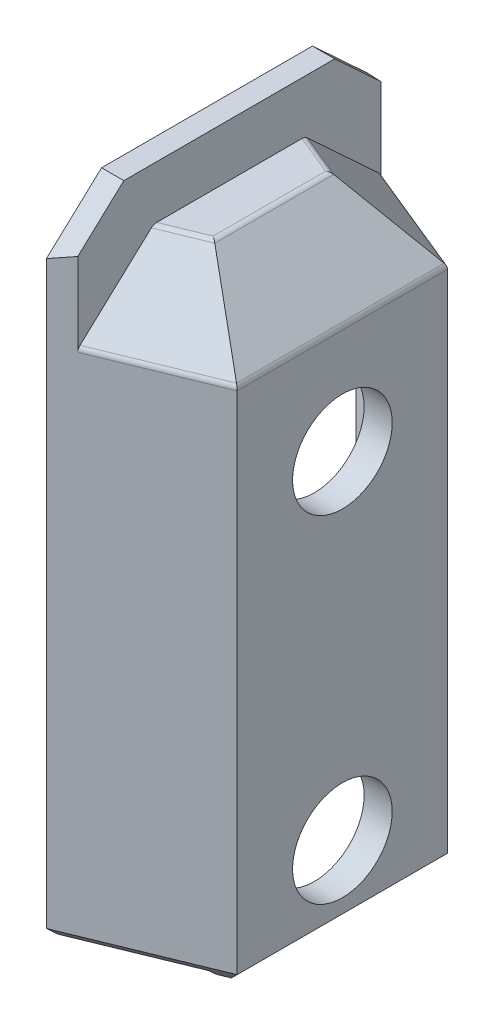
from build123d import *

# Parameters (mm, degrees)
SKETCH1_W            = 30
SKETCH1_H            = 5
BOSS_EXTRUDE1_DEPTH  = 19.3
SKETCH2_W            = 40
SKETCH2_H            = 10
BOSS_EXTRUDE2_DEPTH  = 3.175
SKETCH3_W            = 4
SKETCH3_H            = 30
BOSS_EXTRUDE3_DEPTH  = 75
CUT_EXTRUDE1_REACH   = 84.48
SKETCH4_R            = 7.1
BOSS_EXTRUDE7_DEPTH  = 5
BOSS_EXTRUDE8_DEPTH  = 5
CHAMFER1_SIZE        = 5
BOSS_EXTRUDE9_DEPTH  = 75
BOSS_EXTRUDE10_DEPTH = 5
CHAMFER2_SIZE        = 5
CHAMFER3_SIZE        = 10
BOSS_EXTRUDE15_DEPTH = 3.175
CUT_EXTRUDE2_DEPTH   = 81.759021382
FILLET6_R            = 1
FILLET7_R            = 1
CHAMFER6_SIZE        = 2.5


with BuildPart() as part:
    # Sketch1 → Boss-Extrude1 (new body)
    with BuildSketch(Plane(origin=(0, 0, 0), x_dir=(0, 0, -1), z_dir=(1, 0, 0))):
        Rectangle(SKETCH1_W, SKETCH1_H)
    extrude(amount=BOSS_EXTRUDE1_DEPTH)

    # Sketch2 → Boss-Extrude2 (add)
    with BuildSketch(Plane.ZY):
        with Locations((0.597390222, 2.5)):
            Rectangle(SKETCH2_W, SKETCH2_H)
    extrude(amount=-BOSS_EXTRUDE2_DEPTH)

    # Sketch3 → Boss-Extrude3 (add)
    with BuildSketch(Plane.XZ.offset(2.5)):
        with Locations((17.3, 0)):
            Rectangle(SKETCH3_W, SKETCH3_H)
    extrude(amount=BOSS_EXTRUDE3_DEPTH)

    # Sketch4 → Cut-Extrude1 (cut, up to next)
    with BuildSketch(Plane(origin=(19.3, 0, 0), x_dir=(0, 0, -1), z_dir=(1, 0, 0)), mode=Mode.PRIVATE) as cut_extrude1_sk1:
        with Locations((2.035e-06, -17.9)):
            Circle(SKETCH4_R)
    cut_extrude1_tool1 = extrude(cut_extrude1_sk1.sketch, amount=-CUT_EXTRUDE1_REACH, mode=Mode.PRIVATE) & part.part
    # Sketch4 → Cut-Extrude1 (cut, up to next)
    with BuildSketch(Plane(origin=(19.3, 0, 0), x_dir=(0, 0, -1), z_dir=(1, 0, 0)), mode=Mode.PRIVATE) as cut_extrude1_sk2:
        with Locations((-1.3e-07, -65.9)):
            Circle(SKETCH4_R)
    cut_extrude1_tool2 = extrude(cut_extrude1_sk2.sketch, amount=-CUT_EXTRUDE1_REACH, mode=Mode.PRIVATE) & part.part
    add(cut_extrude1_tool1.solids().sort_by_distance((19.3, -17.9, -2e-06))[0], mode=Mode.SUBTRACT)
    add(cut_extrude1_tool2.solids().sort_by_distance((19.3, -65.9, 0))[0], mode=Mode.SUBTRACT)

    # Sketch10 → Boss-Extrude7 (add)
    with BuildSketch(Plane(origin=(0, 2.5, 0), x_dir=(1, 0, 0), z_dir=(0, 1, 0))):
        Polygon((3.175, 19.402609778), (0, 19.402609778), (0, 22.902609778), (19.3, 15), (3.175, 15), align=None)
    boss_extrude7 = extrude(amount=-BOSS_EXTRUDE7_DEPTH)

    # Sketch11 → Boss-Extrude8 (add)
    with BuildSketch(Plane(origin=(0, 2.5, 0), x_dir=(1, 0, 0), z_dir=(0, 1, 0))):
        Polygon((0, 19.402609778), (0, 22.902609778), (3.175, 21.60256905), (3.175, 19.402609778), align=None)
    boss_extrude8 = extrude(amount=BOSS_EXTRUDE8_DEPTH)

    # Mirror2: Boss-Extrude7, Boss-Extrude8 across plane
    add(boss_extrude7.mirror(Plane(origin=(0, 0, 0), x_dir=(1, 0, 0), z_dir=(0, 0, -1))))
    add(boss_extrude8.mirror(Plane(origin=(0, 0, 0), x_dir=(1, 0, 0), z_dir=(0, 0, -1))))

    # Chamfer1
    chamfer1_edges = [part.edges().sort_by_distance(p)[0] for p in [
        (3.175, 2.5, 0),
    ]]
    chamfer(chamfer1_edges, length=CHAMFER1_SIZE - 0.0001)  # a hair under: the kernel refuses the full size

    # Sketch12 → Boss-Extrude9 (add)
    with BuildSketch(Plane.XZ.offset(2.5)):
        Polygon((0, -22.902609778), (19.3, -15), (15.3, -15), (0, -21.264763192), align=None)
        Polygon((0, 22.902609778), (19.3, 15), (15.3, 15), (0, 21.264763192), align=None)
    extrude(amount=BOSS_EXTRUDE9_DEPTH)

    # Sketch13 → Boss-Extrude10 (add)
    with BuildSketch(Plane(origin=(0, 2.5, 0), x_dir=(1, 0, 0), z_dir=(0, 1, 0))):
        Polygon((3.175, 21.60256905), (3.175, -21.60256905), (19.3, -15), (19.3, 15), align=None)
    extrude(amount=BOSS_EXTRUDE10_DEPTH)

    # Chamfer2
    chamfer2_edges = [part.edges().sort_by_distance(p)[0] for p in [
        (7.65, -2.5, -18.132381596),
        (7.65, -2.5, 18.132381596),
        (15.3, -2.5, 0),
    ]]
    chamfer(chamfer2_edges, length=CHAMFER2_SIZE)

    # Chamfer3
    chamfer3_edges = [part.edges().sort_by_distance(p)[0] for p in [
        (9.65, 7.5, 18.951304889),
        (19.3, 7.5, 0),
        (9.65, 7.5, -18.951304889),
    ]]
    chamfer(chamfer3_edges, length=CHAMFER3_SIZE)

    # Sketch14 → Boss-Extrude15 (add)
    with BuildSketch(Plane.ZY):
        Polygon((-22.902609778, -2.5), (-22.902609778, 7.718772797), (-15.034642071, 15), (15.034642071, 15), (22.902609778, 7.718772797), (22.902609778, -2.5), align=None)
    extrude(amount=-BOSS_EXTRUDE15_DEPTH)

    # Sketch15 → Cut-Extrude2 (cut, through all)
    with BuildSketch(Plane.XZ.offset(2.5)):
        Polygon((3.175, 22.902609778), (0, 22.902609778), (3.175, 21.60256905), align=None)
        Polygon((3.175, -22.902609778), (3.175, -21.60256905), (0, -22.902609778), align=None)
    extrude(amount=-CUT_EXTRUDE2_DEPTH, mode=Mode.SUBTRACT)

    # Fillet6
    fillet6_edges = [part.edges().sort_by_distance(p)[0] for p in [
        (9.3, 7.5, 0),
        (6.2375, 7.5, -9.542766367),
        (6.2375, 7.5, 9.542766367),
    ]]
    fillet(fillet6_edges, radius=FILLET6_R)

    # Fillet7
    fillet7_edges = [part.edges().sort_by_distance(p)[0] for p in [
        (11.2375, -2.5, 18.301284525),
        (19.3, -2.5, 0),
        (11.2375, -2.5, -18.301284525),
    ]]
    fillet(fillet7_edges, radius=FILLET7_R)

    # Chamfer6
    chamfer6_edges = [part.edges().sort_by_distance(p)[0] for p in [
        (9.65, -77.5, -18.951304889),
        (19.3, -77.5, 0),
        (9.65, -77.5, 18.951304889),
    ]]
    chamfer(chamfer6_edges, length=CHAMFER6_SIZE)


solid = part.part
